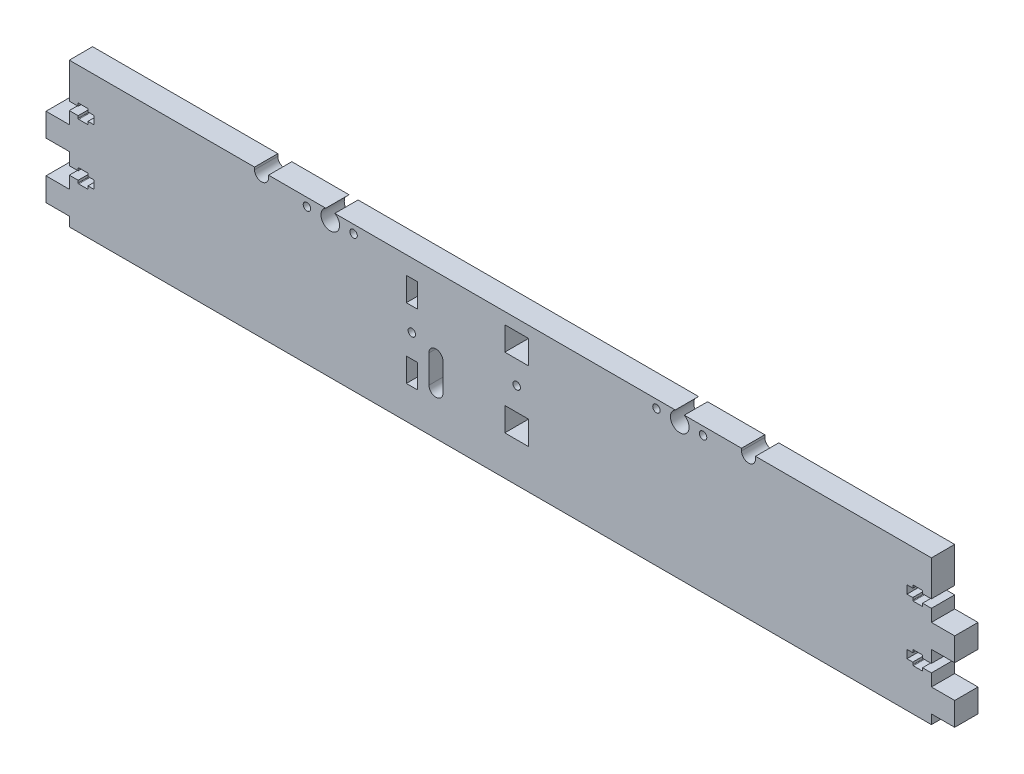
from build123d import *

# Parameters (mm, degrees)
MAINBODY_DEPTH      = 10
SCREWCUTOUTS_DEPTH  = 205.863369102
SKETCH2_R           = 4
SKETCH2_R_2         = 1.6
RODCUTOUTS_DEPTH    = 205.863369102
SKETCH4_R           = 1.6
SKETCH4_W           = 10.2
SKETCH4_H           = 10.2
CUT_EXTRUDE3_DEPTH  = 205.863369102
SKETCH5_R           = 1.6
SKETCH5_W           = 4.7
SKETCH5_H           = 10.2
ENDSTOPHOLDER_DEPTH = 205.863369102
ENDSTOPWIRES_DEPTH  = 205.863369102
CUT_EXTRUDE4_DEPTH  = 205.863369102


with BuildPart() as part:
    # Sketch1 → MainBody (new body)
    with BuildSketch(Plane.XY):
        Polygon((0, 0), (-185, 0), (-185, -24), (-195, -24), (-195, -34), (-185, -34), (-185, -48), (-195, -48), (-195, -58), (-185, -58), (-185, -62), (0, -62), align=None)
    mainbody = extrude(amount=MAINBODY_DEPTH)

    # Sketch3 → ScrewCutouts (cut, through all)
    with BuildSketch(Plane.XY.offset(10)):
        with BuildLine():
            Line((-185, -18.75), (-181.2, -18.75))
            Line((-181.2, -18.75), (-181.2, -19.75))
            ThreePointArc((-181.2, -19.75), (-181.126776695, -19.926776695), (-180.95, -20))
            Line((-180.95, -20), (-177.25, -20))
            ThreePointArc((-177.25, -20), (-177.073223305, -19.926776695), (-177, -19.75))
            Line((-177, -19.75), (-177, -18.75))
            Line((-177, -18.75), (-174.5, -18.75))
            Line((-174.5, -18.75), (-174.5, -15.25))
            Line((-174.5, -15.25), (-177, -15.25))
            Line((-177, -15.25), (-177, -14.25))
            ThreePointArc((-177, -14.25), (-177.073223305, -14.073223305), (-177.25, -14))
            Line((-177.25, -14), (-180.95, -14))
            ThreePointArc((-180.95, -14), (-181.126776695, -14.073223305), (-181.2, -14.25))
            Line((-181.2, -14.25), (-181.2, -15.25))
            Line((-181.2, -15.25), (-185, -15.25))
            Line((-185, -15.25), (-185, -18.75))
        make_face()
        with BuildLine():
            Line((-185, -39.25), (-185, -42.75))
            Line((-185, -42.75), (-181.2, -42.75))
            Line((-181.2, -42.75), (-181.2, -43.75))
            ThreePointArc((-181.2, -43.75), (-181.126776695, -43.926776695), (-180.95, -44))
            Line((-180.95, -44), (-177.25, -44))
            ThreePointArc((-177.25, -44), (-177.073223305, -43.926776695), (-177, -43.75))
            Line((-177, -43.75), (-177, -42.75))
            Line((-177, -42.75), (-174.5, -42.75))
            Line((-174.5, -42.75), (-174.5, -39.25))
            Line((-174.5, -39.25), (-177, -39.25))
            Line((-177, -39.25), (-177, -38.25))
            ThreePointArc((-177, -38.25), (-177.073223305, -38.073223305), (-177.25, -38))
            Line((-177.25, -38), (-180.95, -38))
            ThreePointArc((-180.95, -38), (-181.126776695, -38.073223305), (-181.2, -38.25))
            Line((-181.2, -38.25), (-181.2, -39.25))
            Line((-181.2, -39.25), (-185, -39.25))
        make_face()
    screwcutouts = extrude(amount=-SCREWCUTOUTS_DEPTH, mode=Mode.SUBTRACT)

    # Mirror1: MainBody, ScrewCutouts across plane
    add(mainbody.mirror(Plane(origin=(0, 0, 0), x_dir=(0, 0, 1), z_dir=(1, 0, 0))))
    add(screwcutouts.mirror(Plane(origin=(0, 0, 0), x_dir=(0, 0, 1), z_dir=(1, 0, 0))), mode=Mode.SUBTRACT)

    # Sketch2 → RodCutouts (cut, through all)
    with BuildSketch(Plane.XY.offset(10)):
        with Locations((-73, -3.5)):
            Circle(SKETCH2_R)
        with Locations((-83, -3.5)):
            Circle(SKETCH2_R_2)
        with Locations((-63, -3.5)):
            Circle(SKETCH2_R_2)
        with Locations((67, -3.5)):
            Circle(SKETCH2_R_2)
        with Locations((87, -3.5)):
            Circle(SKETCH2_R_2)
        with Locations((77, -3.5)):
            Circle(SKETCH2_R)
    extrude(amount=-RODCUTOUTS_DEPTH, mode=Mode.SUBTRACT)

    # Sketch4 → Cut-Extrude3 (cut, through all)
    with BuildSketch(Plane.XY.offset(10)):
        with Locations((7, -25)):
            Circle(SKETCH4_R)
        with Locations((7, -10)):
            Rectangle(SKETCH4_W, SKETCH4_H)
        with Locations((7, -40)):
            Rectangle(SKETCH4_W, SKETCH4_H)
    extrude(amount=-CUT_EXTRUDE3_DEPTH, mode=Mode.SUBTRACT)

    # Sketch5 → EndstopHolder (cut, through all)
    with BuildSketch(Plane.XY.offset(10)):
        with Locations((-38, -27.75)):
            Circle(SKETCH5_R)
        with Locations((-38, -12.75)):
            Rectangle(SKETCH5_W, SKETCH5_H)
        with Locations((-38, -42.75)):
            Rectangle(SKETCH5_W, SKETCH5_H)
    extrude(amount=-ENDSTOPHOLDER_DEPTH, mode=Mode.SUBTRACT)

    # Sketch6 → EndstopWires (cut, through all)
    with BuildSketch(Plane.XY.offset(10)):
        with BuildLine():
            Line((-30.65, -43.65), (-30.65, -31.65))
            ThreePointArc((-30.65, -31.65), (-27.65, -28.65), (-24.65, -31.65))
            Line((-24.65, -31.65), (-24.65, -43.65))
            ThreePointArc((-24.65, -43.65), (-27.65, -46.65), (-30.65, -43.65))
        make_face()
    extrude(amount=-ENDSTOPWIRES_DEPTH, mode=Mode.SUBTRACT)

    # Sketch7 → Cut-Extrude4 (cut, through all)
    with BuildSketch(Plane.XY.offset(10)):
        with BuildLine():
            Line((-99.5, 0), (-99.5, -1))
            ThreePointArc((-99.5, -1), (-102.5, -4), (-105.5, -1))
            Line((-105.5, -1), (-105.5, 0))
            ThreePointArc((-105.5, 0), (-102.5, 3), (-99.5, 0))
        make_face()
        with BuildLine():
            Line((103.5, 0), (103.5, -1))
            ThreePointArc((103.5, -1), (106.5, -4), (109.5, -1))
            Line((109.5, -1), (109.5, 0))
            ThreePointArc((109.5, 0), (106.5, 3), (103.5, 0))
        make_face()
    extrude(amount=-CUT_EXTRUDE4_DEPTH, mode=Mode.SUBTRACT)


solid = part.part
